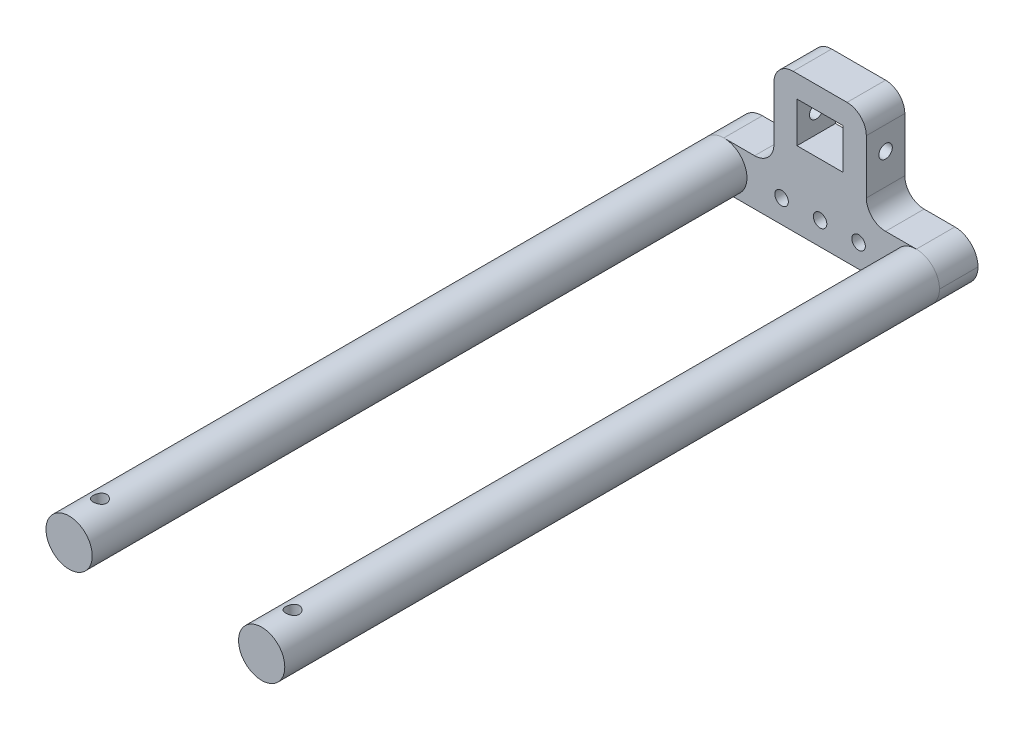
from build123d import *

# Parameters (mm, degrees)
SKETCH1_W               = 62
SKETCH1_H               = 12
BOSS_EXTRUDE1_DEPTH     = 10
SKETCH2_R               = 6
BOSS_EXTRUDE2_DEPTH     = 170
SKETCH3_W               = 24
SKETCH3_H               = 10
BOSS_EXTRUDE3_DEPTH     = 24
CUT_EXTRUDE1_REACH      = 187.097
SKETCH4_W               = 12
SKETCH4_H               = 10.5
SKETCH5_R               = 1.75
CUT_EXTRUDE2_DEPTH      = 188.48066567
FILLET1_R               = 6
FILLET2_R               = 5
CUT_EXTRUDE3_DEPTH      = 186.097271725
CUT_EXTRUDE3_DEPTH_BACK = 186.097271725
SKETCH6_R               = 1.75
CUT_EXTRUDE4_REACH      = 187.097
SKETCH7_R               = 1.75
CUT_EXTRUDE5_REACH      = 187.097
SKETCH8_R               = 1.75


with BuildPart() as part:
    # Sketch1 → Boss-Extrude1 (new body)
    with BuildSketch(Plane.XY):
        Rectangle(SKETCH1_W, SKETCH1_H)
    extrude(amount=BOSS_EXTRUDE1_DEPTH)

    # Sketch2 → Boss-Extrude2 (add)
    with BuildSketch(Plane.XY.offset(10)):
        with Locations(Location((-25, 0, 0), (0, 0, 180))):
            Circle(SKETCH2_R)
        with Locations((25, 0)):
            Circle(SKETCH2_R)
    extrude(amount=BOSS_EXTRUDE2_DEPTH)

    # Sketch3 → Boss-Extrude3 (add)
    with BuildSketch(Plane(origin=(0, 6, 0), x_dir=(1, 0, 0), z_dir=(0, 1, 0))):
        with Locations((0, -5)):
            Rectangle(SKETCH3_W, SKETCH3_H)
    extrude(amount=BOSS_EXTRUDE3_DEPTH)

    # Sketch4 → Cut-Extrude1 (cut, up to next)
    with BuildSketch(Plane(origin=(0, 0, 0), x_dir=(-1, 0, 0), z_dir=(0, 0, -1)), mode=Mode.PRIVATE) as cut_extrude1_sk1:
        with Locations((0, 19)):
            Rectangle(SKETCH4_W, SKETCH4_H)
    cut_extrude1_tool1 = extrude(cut_extrude1_sk1.sketch, amount=-CUT_EXTRUDE1_REACH, mode=Mode.PRIVATE) & part.part
    add(cut_extrude1_tool1.solids().sort_by_distance((0, 19, 0))[0], mode=Mode.SUBTRACT)

    # Sketch5 → Cut-Extrude2 (cut, through all)
    with BuildSketch(Plane(origin=(12, 0, 0), x_dir=(0, 0, -1), z_dir=(1, 0, 0))):
        with Locations((-5, 19)):
            Circle(SKETCH5_R)
    extrude(amount=-CUT_EXTRUDE2_DEPTH, mode=Mode.SUBTRACT)

    # Fillet1
    fillet1_edges = [part.edges().sort_by_distance(p)[0] for p in [
        (-31, -6, 5),
        (-31, 6, 5),
        (31, 6, 5),
        (31, -6, 5),
    ]]
    fillet(fillet1_edges, radius=FILLET1_R - 0.0001)  # a hair under: the kernel refuses the full size

    # Fillet2
    fillet2_edges = [part.edges().sort_by_distance(p)[0] for p in [
        (-12, 6, 5),
        (12, 6, 5),
        (-12, 30, 5),
        (12, 30, 5),
    ]]
    fillet(fillet2_edges, radius=FILLET2_R)

    # Sketch6 → Cut-Extrude3 (cut, two sides: drawn at the far end of the back side and taken through both)
    with BuildSketch(Plane(origin=(0, 0, 0), x_dir=(1, 0, 0), z_dir=(0, 1, 0)).offset(-CUT_EXTRUDE3_DEPTH_BACK)):
        with Locations(Location((-25, -172, 0), (0, 0, 270))):
            Circle(SKETCH6_R)
        with Locations(Location((25, -172, 0), (0, 0, 270))):
            Circle(SKETCH6_R)
    extrude(amount=CUT_EXTRUDE3_DEPTH + CUT_EXTRUDE3_DEPTH_BACK, mode=Mode.SUBTRACT)

    # Sketch7 → Cut-Extrude4 (cut, up to next)
    with BuildSketch(Plane(origin=(0, 0, 0), x_dir=(-1, 0, 0), z_dir=(0, 0, -1)), mode=Mode.PRIVATE) as cut_extrude4_sk1:
        with Locations((-10, 0)):
            Circle(SKETCH7_R)
    cut_extrude4_tool1 = extrude(cut_extrude4_sk1.sketch, amount=-CUT_EXTRUDE4_REACH, mode=Mode.PRIVATE) & part.part
    # Sketch7 → Cut-Extrude4 (cut, up to next)
    with BuildSketch(Plane(origin=(0, 0, 0), x_dir=(-1, 0, 0), z_dir=(0, 0, -1)), mode=Mode.PRIVATE) as cut_extrude4_sk2:
        with Locations((10, 0)):
            Circle(SKETCH7_R)
    cut_extrude4_tool2 = extrude(cut_extrude4_sk2.sketch, amount=-CUT_EXTRUDE4_REACH, mode=Mode.PRIVATE) & part.part
    add(cut_extrude4_tool1.solids().sort_by_distance((10, 0, 0))[0], mode=Mode.SUBTRACT)
    add(cut_extrude4_tool2.solids().sort_by_distance((-10, 0, 0))[0], mode=Mode.SUBTRACT)

    # Sketch8 → Cut-Extrude5 (cut, up to next)
    with BuildSketch(Plane(origin=(0, 0, 0), x_dir=(-1, 0, 0), z_dir=(0, 0, -1)), mode=Mode.PRIVATE) as cut_extrude5_sk1:
        Circle(SKETCH8_R)
    cut_extrude5_tool1 = extrude(cut_extrude5_sk1.sketch, amount=-CUT_EXTRUDE5_REACH, mode=Mode.PRIVATE) & part.part
    add(cut_extrude5_tool1.solids().sort_by_distance((0, 0, 0))[0], mode=Mode.SUBTRACT)


solid = part.part
